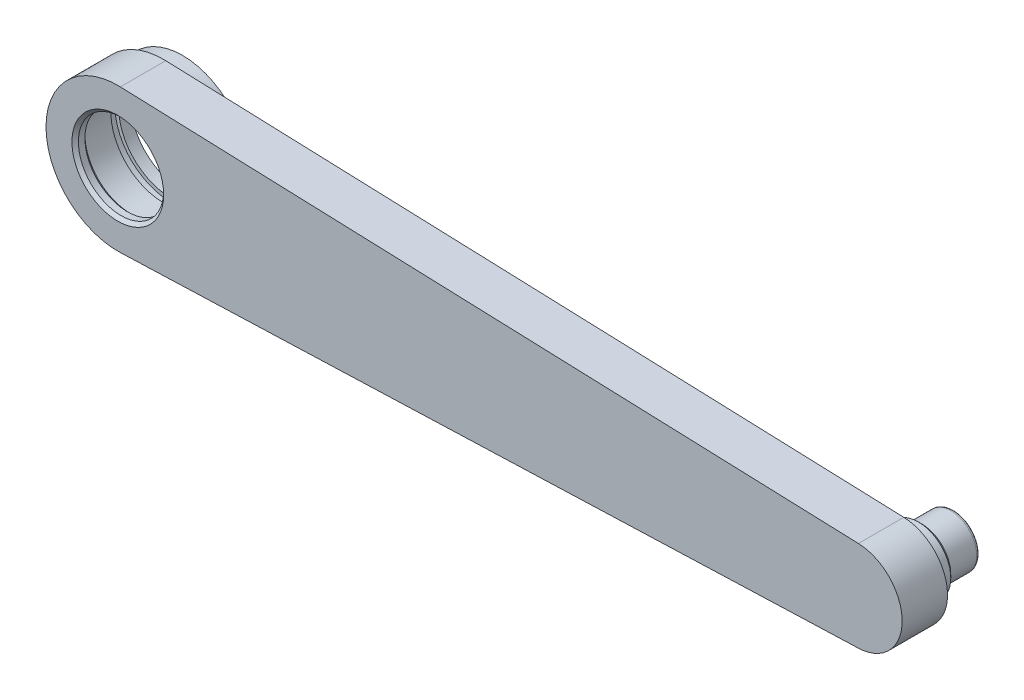
from build123d import *

# Parameters (mm, degrees)
SKETCH_1_R          = 8.075
EXTRUDE_1_DEPTH     = 7
EXTRUDE_START       = -2
SKETCH_2_R          = 8.075
SKETCH_2_R_2        = 6.575
EXTRUDE_2_DEPTH     = 2
SKETCH_3_R          = 4
EXTRUDE_3_DEPTH     = 10
SKETCH_4_R          = 5
SKETCH_4_R_2        = 4
EXTRUDE_4_DEPTH     = 3
CHAMFER_1_SIZE      = 0.5
CUT_EXTRUDE_1_DEPTH = 7
CUT_EXTRUDE_2_DEPTH = 5
CUT_EXTRUDE_START   = -2
SKETCH_8_R          = 4
CUT_EXTRUDE_3_DEPTH = 2
FILLET_1_R          = 0.5
SKETCH_9_R          = 2.2
CUT_EXTRUDE_4_DEPTH = 10
EXTRUDE_START_2     = 3
SKETCH_10_R         = 10.075
SKETCH_10_R_2       = 8.075
EXTRUDE_5_DEPTH     = 3
EXTRUDE_6_DEPTH     = 2
EXTRUDE_START_3     = 5
EXTRUDE_7_DEPTH     = 5


with BuildPart() as part:
    # 草图1 → 凸台-拉伸1 (new body)
    with BuildSketch(Plane.XY):
        with BuildLine():
            ThreePointArc((0.395882675, 11.067922204), (-11.074999998, -0.000217919), (0.396318234, -11.067906616))
            Line((0.396318234, -11.067906616), (114, -7))
            ThreePointArc((114, -7), (120.998881523, -0.125129643), (114.250219298, 6.995526449))
            Line((114.250219298, 6.995526449), (0.395882675, 11.067922204))
        make_face()
        Circle(SKETCH_1_R, mode=Mode.SUBTRACT)
    extrude(amount=EXTRUDE_1_DEPTH)

    # 草图2 → 凸台-拉伸2 (add)
    with BuildSketch(Plane.XY.offset(7).offset(EXTRUDE_START)):
        Circle(SKETCH_2_R)
        Circle(SKETCH_2_R_2, mode=Mode.SUBTRACT)
    extrude(amount=EXTRUDE_2_DEPTH)

    # 草图3 → 凸台-拉伸3 (add)
    with BuildSketch(Plane(origin=(0, 0, 0), x_dir=(-1, 0, 0), z_dir=(0, 0, -1))):
        with Locations((-114, 0)):
            Circle(SKETCH_3_R)
    extrude(amount=EXTRUDE_3_DEPTH)

    # 草图4 → 凸台-拉伸4 (add)
    with BuildSketch(Plane(origin=(0, 0, 0), x_dir=(-1, 0, 0), z_dir=(0, 0, -1))):
        with Locations(Location((-114, 0, 0), (0, 0, 180))):
            Circle(SKETCH_4_R)
        with Locations((-114, 0)):
            Circle(SKETCH_4_R_2, mode=Mode.SUBTRACT)
    extrude(amount=EXTRUDE_4_DEPTH)

    # 倒角1
    chamfer_1_edges = [part.edges().sort_by_distance(p)[0] for p in [
        (-6.575, 0, 5),
        (-6.575, 0, 7),
        (118, 0, -10),
        (109, 0, -3),
    ]]
    chamfer(chamfer_1_edges, length=CHAMFER_1_SIZE)

    # 草图5 → 切除-拉伸1 (cut)
    with BuildSketch(Plane(origin=(0, 0, 0), x_dir=(-1, 0, 0), z_dir=(0, 0, -1))):
        with BuildLine():
            ThreePointArc((-12.757234161, -4.640431182), (-13.574999998, 0.000234775), (-12.757073645, 4.640872443))
            Line((-12.757073645, 4.640872443), (-104.114755838, 1.510611753))
            ThreePointArc((-104.114755838, 1.510611753), (-104.028730231, 0.75748214), (-104, 0))
            ThreePointArc((-104, 0), (-104.028593207, -0.755676237), (-104.114209315, -1.507031033))
            Line((-104.114209315, -1.507031033), (-12.757234161, -4.640431182))
        make_face()
    extrude(amount=-CUT_EXTRUDE_1_DEPTH, mode=Mode.SUBTRACT)

    # 草图6 → 切除-拉伸2 (cut)
    with BuildSketch(Plane(origin=(0, 0, 0), x_dir=(-1, 0, 0), z_dir=(0, 0, -1))):
        Polygon((-104.114209315, -1.507031033), (-12.757234161, -4.640431182), (-12.860068961, -7.638668165), (-104.217044114, -4.505268015), align=None)
        Polygon((-12.757073645, 4.640872443), (-104.114755838, 1.510611753), (-104.217486931, 4.508852291), (-12.859804737, 7.63911298), align=None)
    extrude(amount=-CUT_EXTRUDE_2_DEPTH, mode=Mode.SUBTRACT)

    # 草图8 → 切除-拉伸3 (cut)
    with BuildSketch(Plane(origin=(0, 0, -10), x_dir=(-1, 0, 0), z_dir=(0, 0, -1)).offset(CUT_EXTRUDE_START)):
        with Locations((-114, 0)):
            Circle(SKETCH_8_R)
    extrude(amount=CUT_EXTRUDE_3_DEPTH, mode=Mode.SUBTRACT)

    # 圆角1
    fillet_1_edges = [part.edges().sort_by_distance(p)[0] for p in [
        (118, 0, -8),
    ]]
    fillet(fillet_1_edges, radius=FILLET_1_R)

    # 草图9 → 切除-拉伸4 (cut)
    with BuildSketch(Plane(origin=(0, 0, -8), x_dir=(-1, 0, 0), z_dir=(0, 0, -1))):
        with Locations((-114, 0)):
            Circle(SKETCH_9_R)
    extrude(amount=-CUT_EXTRUDE_4_DEPTH, mode=Mode.SUBTRACT)

    # 草图10 → 凸台-拉伸5 (add)
    with BuildSketch(Plane(origin=(0, 0, 0), x_dir=(-1, 0, 0), z_dir=(0, 0, -1)).offset(EXTRUDE_START_2)):
        with Locations(Location((0, 0, 0), (0, 0, 180))):
            Circle(SKETCH_10_R)
        Circle(SKETCH_10_R_2, mode=Mode.SUBTRACT)
    extrude(amount=-EXTRUDE_5_DEPTH)

    # 切除-旋转2: read off the stored shape, not the designer's step
    # 切除-旋转2: loft between two sections, ruled curve by curve
    cut_revolve_2_from = [
        Edge.make_three_point_arc((8.65, 0, -1.2), (0, 8.65, -1.2), (-8.65, 0, -1.2)),
        Edge.make_three_point_arc((-8.65, 0, -1.2), (0, -8.65, -1.2), (8.65, 0, -1.2)),
    ]
    cut_revolve_2_to = [
        Edge.make_three_point_arc((8.65, 0, 0), (0, 8.65, 0), (-8.65, 0, 0)),
        Edge.make_three_point_arc((-8.65, 0, 0), (0, -8.65, 0), (8.65, 0, 0)),
    ]
    cut_revolve_2 = Solid(Shell([*[Face.make_surface_from_curves(cut_revolve_2_from[k], cut_revolve_2_to[k]) for k in range(2)], Face(Wire(cut_revolve_2_from)), Face(Wire(cut_revolve_2_to))]))
    add(cut_revolve_2, mode=Mode.SUBTRACT)

    # 草图12 → 凸台-拉伸6 (add)
    with BuildSketch(Plane.XY.offset(7).offset(EXTRUDE_START)):
        with BuildLine():
            Line((104.114209315, -1.507031033), (12.757234161, -4.640431182))
            ThreePointArc((12.757234161, -4.640431182), (13.574999998, 0.000234775), (12.757073645, 4.640872443))
            Line((12.757073645, 4.640872443), (104.114755838, 1.510611753))
            ThreePointArc((104.114755838, 1.510611753), (104.000000164, 0.001811094), (104.114209315, -1.507031033))
        make_face()
    extrude(amount=EXTRUDE_6_DEPTH)

    # 草图13 → 凸台-拉伸7 (add)
    with BuildSketch(Plane(origin=(0, 0, 5), x_dir=(-1, 0, 0), z_dir=(0, 0, -1)).offset(EXTRUDE_START_3)):
        with BuildLine():
            Line((-104.114209315, -1.507031033), (-104.217044114, -4.505268015))
            Line((-104.217044114, -4.505268015), (-12.860068961, -7.638668165))
            Line((-12.860068961, -7.638668165), (-12.757234161, -4.640431182))
            ThreePointArc((-12.757234161, -4.640431182), (-13.574999998, 0.000234775), (-12.757073645, 4.640872443))
            Line((-12.757073645, 4.640872443), (-12.859804737, 7.63911298))
            Line((-12.859804737, 7.63911298), (-104.217486931, 4.508852291))
            Line((-104.217486931, 4.508852291), (-104.114755838, 1.510611753))
            ThreePointArc((-104.114755838, 1.510611753), (-104.000000164, 0.001811094), (-104.114209315, -1.507031033))
        make_face()
    extrude(amount=-EXTRUDE_7_DEPTH)


solid = part.part
